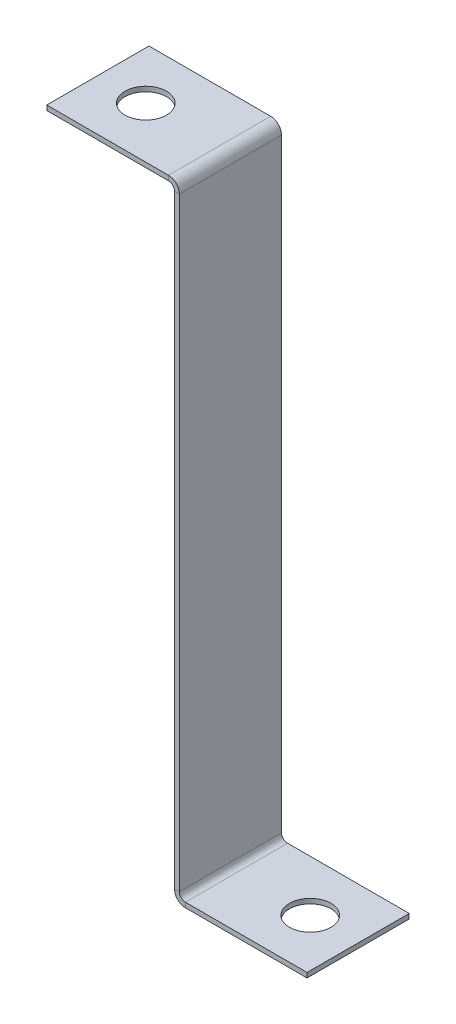
from build123d import *

# Parameters (mm, degrees)
SKETCH1_W                    = 25.4
SKETCH1_H                    = 155.575
BASE_FLANGE1_DEPTH           = 1.1938
EDGE_FLANGE1_STRIP_W         = 7.7724
EDGE_FLANGE1_STRIP_H         = 1.1938
EDGE_FLANGE1_STRIP_CUT_DEPTH = 25.4
EDGE_FLANGE1_DEPTH           = 25.4
SKETCH11_R                   = 5.159375
CUT_EXTRUDE1_DEPTH           = 162.040474985
EDGE_FLANGE2_STRIP_W         = 7.7724
EDGE_FLANGE2_STRIP_H         = 1.1938
EDGE_FLANGE2_STRIP_CUT_DEPTH = 25.4
EDGE_FLANGE2_DEPTH           = 25.4
SKETCH15_R                   = 5.159375
CUT_EXTRUDE2_DEPTH           = 162.040474985


# Sheet-metal steps are written as plain solids
with BuildPart() as part:
    # Sketch1 → Base-Flange1 (new body)
    with BuildSketch(Plane(origin=(0, 0, 0), x_dir=(0, 0, -1), z_dir=(1, 0, 0))):
        with Locations((12.7, 77.7875)):
            Rectangle(SKETCH1_W, SKETCH1_H)
    extrude(amount=-BASE_FLANGE1_DEPTH)

    # Edge-Flange1 strip (across the edge) → Edge-Flange1 strip cut (cut)
    with BuildSketch(Plane(origin=(-1.1938, 155.575, 0), x_dir=(0, -1, 0), z_dir=(0, 0, -1))):
        with Locations((-1.1938, -0.5969)):
            Rectangle(EDGE_FLANGE1_STRIP_W, EDGE_FLANGE1_STRIP_H)
    extrude(amount=EDGE_FLANGE1_STRIP_CUT_DEPTH, mode=Mode.SUBTRACT)

    # Edge-Flange1 section (across the edge) → Edge-Flange1 (add)
    with BuildSketch(Plane(origin=(-1.1938, 155.575, 0), x_dir=(0, -1, 0), z_dir=(0, 0, -1))):
        with BuildLine():
            Line((0, 1.4986), (0, 31.75))
            Line((0, 31.75), (1.1938, 31.75))
            Line((1.1938, 31.75), (1.1938, 1.4986))
            ThreePointArc((1.1938, 1.4986), (1.632729778, 0.438929778), (2.6924, 0))
            Line((2.6924, 0), (2.6924, -1.1938))
            ThreePointArc((2.6924, -1.1938), (0.788585702, -0.405214298), (0, 1.4986))
        make_face()
    extrude(amount=EDGE_FLANGE1_DEPTH)

    # Sketch11 → Cut-Extrude1 (cut, through all)
    with BuildSketch(Plane(origin=(0, 155.575, 0), x_dir=(1, 0, 0), z_dir=(0, 1, 0))):
        with Locations(Location((-21.03755, 12.7, 0), (0, 0, 180))):
            Circle(SKETCH11_R)
    extrude(amount=-CUT_EXTRUDE1_DEPTH, mode=Mode.SUBTRACT)

    # Edge-Flange2 strip (across the edge) → Edge-Flange2 strip cut (cut)
    with BuildSketch(Plane.YX):
        with Locations((-1.1938, -0.5969)):
            Rectangle(EDGE_FLANGE2_STRIP_W, EDGE_FLANGE2_STRIP_H)
    extrude(amount=EDGE_FLANGE2_STRIP_CUT_DEPTH, mode=Mode.SUBTRACT)

    # Edge-Flange2 section (across the edge) → Edge-Flange2 (add)
    with BuildSketch(Plane.YX):
        with BuildLine():
            Line((0, 1.4986), (0, 31.75))
            Line((0, 31.75), (1.1938, 31.75))
            Line((1.1938, 31.75), (1.1938, 1.4986))
            ThreePointArc((1.1938, 1.4986), (1.632729778, 0.438929778), (2.6924, 0))
            Line((2.6924, 0), (2.6924, -1.1938))
            ThreePointArc((2.6924, -1.1938), (0.788585702, -0.405214298), (0, 1.4986))
        make_face()
    extrude(amount=EDGE_FLANGE2_DEPTH)

    # Sketch15 → Cut-Extrude2 (cut, through all)
    with BuildSketch(Plane.XZ):
        with Locations((19.84375, -12.7)):
            Circle(SKETCH15_R)
    extrude(amount=-CUT_EXTRUDE2_DEPTH, mode=Mode.SUBTRACT)


solid = part.part
